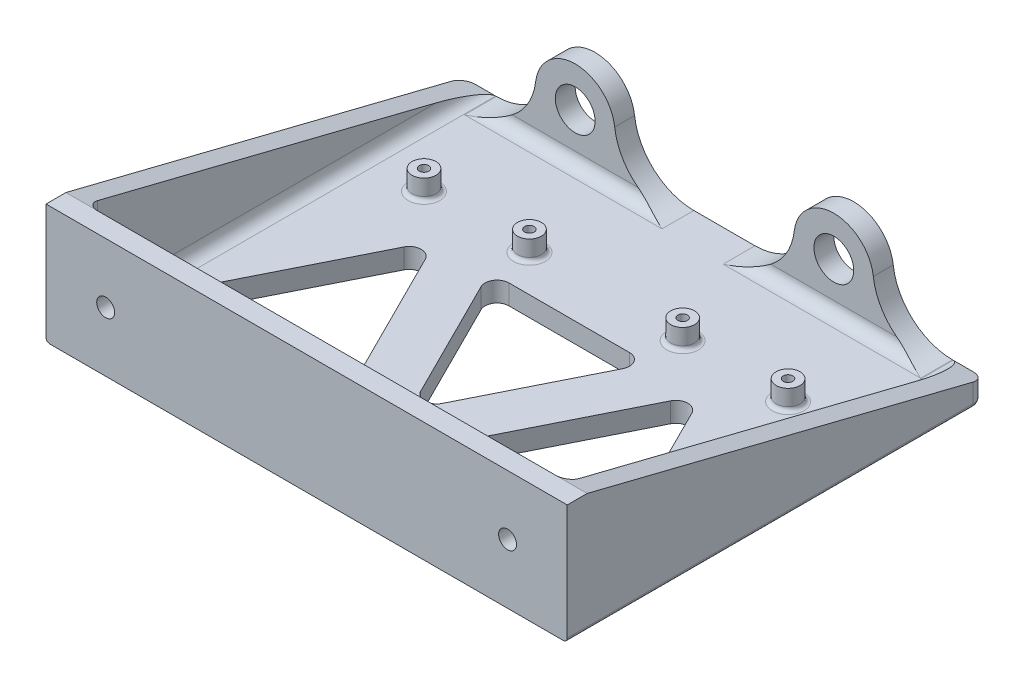
from build123d import *

# Parameters (mm, degrees)
SKETCH1_R             = 3
SKETCH1_R_2           = 1.2
BOSS_EXTRUDE1_DEPTH   = 10
BOSS_EXTRUDE1_2_DEPTH = 10
BOSS_EXTRUDE1_3_DEPTH = 10
BOSS_EXTRUDE1_4_DEPTH = 10
BOSS_EXTRUDE1_5_DEPTH = 10
BOSS_EXTRUDE1_6_DEPTH = 10
BOSS_EXTRUDE1_7_DEPTH = 10
BOSS_EXTRUDE1_8_DEPTH = 10
SKETCH2_W             = 131
SKETCH2_H             = 100
SKETCH2_R             = 1.2
BOSS_EXTRUDE2_DEPTH   = 5
SKETCH5_W             = 131
SKETCH5_H             = 30
BOSS_EXTRUDE4_DEPTH   = 5
BOSS_EXTRUDE5_DEPTH   = 5
FILLET2_R             = 3
SKETCH7_R             = 2.25
CUT_EXTRUDE2_DEPTH    = 5
SKETCH8_R             = 5
BOSS_EXTRUDE6_DEPTH   = 5
FILLET5_R             = 15
FILLET6_R             = 3
FILLET5_OF_MIRROR2_R  = 15
FILLET6_OF_MIRROR2_R  = 3
FILLET7_R             = 1
FILLET8_R             = 1
CUT_EXTRUDE3_DEPTH    = 5
FILLET9_R             = 3


with BuildPart() as part:
    # Sketch1 → Boss-Extrude1 (new body)
    with BuildSketch(Plane(origin=(0, 0, 0), x_dir=(1, 0, 0), z_dir=(0, 1, 0))):
        with Locations(Location((-45.75, 29.25, 0), (0, 0, 270))):
            Circle(SKETCH1_R)
        with Locations(Location((-45.75, 29.25, 0), (0, 0, 270))):
            Circle(SKETCH1_R_2, mode=Mode.SUBTRACT)
    extrude(amount=BOSS_EXTRUDE1_DEPTH)



with BuildPart() as body_2:
    # Sketch1 → Boss-Extrude1 2 (new body)
    with BuildSketch(Plane(origin=(0, 0, 0), x_dir=(1, 0, 0), z_dir=(0, 1, 0))):
        with Locations(Location((-19.25, 29.25, 0), (0, 0, 270))):
            Circle(SKETCH1_R)
        with Locations(Location((-19.25, 29.25, 0), (0, 0, 270))):
            Circle(SKETCH1_R_2, mode=Mode.SUBTRACT)
    extrude(amount=BOSS_EXTRUDE1_2_DEPTH)


with BuildPart() as body_3:
    # Sketch1 → Boss-Extrude1 3 (new body)
    with BuildSketch(Plane(origin=(0, 0, 0), x_dir=(1, 0, 0), z_dir=(0, 1, 0))):
        with Locations(Location((-45.75, -29.25, 0), (0, 0, 270))):
            Circle(SKETCH1_R)
        with Locations(Location((-45.75, -29.25, 0), (0, 0, 270))):
            Circle(SKETCH1_R_2, mode=Mode.SUBTRACT)
    extrude(amount=BOSS_EXTRUDE1_3_DEPTH)


with BuildPart() as body_4:
    # Sketch1 → Boss-Extrude1 4 (new body)
    with BuildSketch(Plane(origin=(0, 0, 0), x_dir=(1, 0, 0), z_dir=(0, 1, 0))):
        with Locations(Location((-19.25, -29.25, 0), (0, 0, 270))):
            Circle(SKETCH1_R)
        with Locations(Location((-19.25, -29.25, 0), (0, 0, 270))):
            Circle(SKETCH1_R_2, mode=Mode.SUBTRACT)
    extrude(amount=BOSS_EXTRUDE1_4_DEPTH)


with BuildPart() as body_5:
    # Sketch1 → Boss-Extrude1 5 (new body)
    with BuildSketch(Plane(origin=(0, 0, 0), x_dir=(1, 0, 0), z_dir=(0, 1, 0))):
        with Locations(Location((19.25, 29.25, 0), (0, 0, 270))):
            Circle(SKETCH1_R)
        with Locations(Location((19.25, 29.25, 0), (0, 0, 270))):
            Circle(SKETCH1_R_2, mode=Mode.SUBTRACT)
    extrude(amount=BOSS_EXTRUDE1_5_DEPTH)


with BuildPart() as body_6:
    # Sketch1 → Boss-Extrude1 6 (new body)
    with BuildSketch(Plane(origin=(0, 0, 0), x_dir=(1, 0, 0), z_dir=(0, 1, 0))):
        with Locations(Location((45.75, 29.25, 0), (0, 0, 270))):
            Circle(SKETCH1_R)
        with Locations(Location((45.75, 29.25, 0), (0, 0, 270))):
            Circle(SKETCH1_R_2, mode=Mode.SUBTRACT)
    extrude(amount=BOSS_EXTRUDE1_6_DEPTH)


with BuildPart() as body_7:
    # Sketch1 → Boss-Extrude1 7 (new body)
    with BuildSketch(Plane(origin=(0, 0, 0), x_dir=(1, 0, 0), z_dir=(0, 1, 0))):
        with Locations(Location((45.75, -29.25, 0), (0, 0, 270))):
            Circle(SKETCH1_R)
        with Locations(Location((45.75, -29.25, 0), (0, 0, 270))):
            Circle(SKETCH1_R_2, mode=Mode.SUBTRACT)
    extrude(amount=BOSS_EXTRUDE1_7_DEPTH)


with BuildPart() as body_8:
    # Sketch1 → Boss-Extrude1 8 (new body)
    with BuildSketch(Plane(origin=(0, 0, 0), x_dir=(1, 0, 0), z_dir=(0, 1, 0))):
        with Locations(Location((19.25, -29.25, 0), (0, 0, 270))):
            Circle(SKETCH1_R)
        with Locations(Location((19.25, -29.25, 0), (0, 0, 270))):
            Circle(SKETCH1_R_2, mode=Mode.SUBTRACT)
    extrude(amount=BOSS_EXTRUDE1_8_DEPTH)


with BuildPart() as part_1:
    add(part.part)

    add(body_2.part)  # Boss-Extrude2 merges body 2

    add(body_3.part)  # Boss-Extrude2 merges body 3

    add(body_4.part)  # Boss-Extrude2 merges body 4

    add(body_5.part)  # Boss-Extrude2 merges body 5

    add(body_6.part)  # Boss-Extrude2 merges body 6

    add(body_7.part)  # Boss-Extrude2 merges body 7

    add(body_8.part)  # Boss-Extrude2 merges body 8
    # Sketch2 → Boss-Extrude2 (add)
    with BuildSketch(Plane(origin=(0, 0, 0), x_dir=(1, 0, 0), z_dir=(0, 1, 0))):
        with Locations((0, 9)):
            Rectangle(SKETCH2_W, SKETCH2_H)
        with Locations(Location((45.75, -29.25, 0), (0, 0, 270))):
            Circle(SKETCH2_R, mode=Mode.SUBTRACT)
        with Locations(Location((19.25, -29.25, 0), (0, 0, 270))):
            Circle(SKETCH2_R, mode=Mode.SUBTRACT)
        with Locations(Location((-19.25, -29.25, 0), (0, 0, 270))):
            Circle(SKETCH2_R, mode=Mode.SUBTRACT)
        with Locations(Location((-45.75, -29.25, 0), (0, 0, 270))):
            Circle(SKETCH2_R, mode=Mode.SUBTRACT)
        with Locations(Location((-45.75, 29.25, 0), (0, 0, 270))):
            Circle(SKETCH2_R, mode=Mode.SUBTRACT)
        with Locations(Location((-19.25, 29.25, 0), (0, 0, 270))):
            Circle(SKETCH2_R, mode=Mode.SUBTRACT)
        with Locations(Location((19.25, 29.25, 0), (0, 0, 270))):
            Circle(SKETCH2_R, mode=Mode.SUBTRACT)
        with Locations(Location((45.75, 29.25, 0), (0, 0, 270))):
            Circle(SKETCH2_R, mode=Mode.SUBTRACT)
    extrude(amount=BOSS_EXTRUDE2_DEPTH)

    # Sketch5 → Boss-Extrude4 (add)
    with BuildSketch(Plane.XY.offset(41)):
        with Locations((0, 15)):
            Rectangle(SKETCH5_W, SKETCH5_H)
    extrude(amount=BOSS_EXTRUDE4_DEPTH)

    # Sketch6 → Boss-Extrude5 (add)
    with BuildSketch(Plane.ZY.offset(65.5)):
        Polygon((-59, 5), (41, 30), (41, 5), align=None)
    boss_extrude5 = extrude(amount=-BOSS_EXTRUDE5_DEPTH)

    # Mirror1: Boss-Extrude5 across plane
    add(boss_extrude5.mirror(Plane(origin=(0, 0, 0), x_dir=(0, 0, 1), z_dir=(1, 0, 0))))

    # Fillet2
    fillet2_edges = [part_1.edges().sort_by_distance(p)[0] for p in [
        (60.5, 5, -9),
        (60.5, 17.5, 41),
        (-65.5, 2.5, -59),
        (65.5, 2.5, -59),
        (0, 5, 41),
        (-60.5, 5, -9),
        (-60.5, 17.5, 41),
    ]]
    fillet(fillet2_edges, radius=FILLET2_R)

    # Sketch7 → Cut-Extrude2 (cut)
    with BuildSketch(Plane.XY.offset(46)):
        with Locations((-50.5, 15)):
            Circle(SKETCH7_R)
        with Locations((50.5, 15)):
            Circle(SKETCH7_R)
    extrude(amount=-CUT_EXTRUDE2_DEPTH, mode=Mode.SUBTRACT)

    # Sketch8 → Boss-Extrude6 (add)
    with BuildSketch(Plane(origin=(0, 0, -59), x_dir=(-1, 0, 0), z_dir=(0, 0, -1))):
        with BuildLine():
            Line((-42.5, 17), (-42.5, 0))
            Line((-42.5, 0), (-22.5, 0))
            Line((-22.5, 0), (-22.5, 17))
            ThreePointArc((-22.5, 17), (-32.5, 27), (-42.5, 17))
        make_face()
        with Locations((-32.5, 17)):
            Circle(SKETCH8_R, mode=Mode.SUBTRACT)
    boss_extrude6 = extrude(amount=-BOSS_EXTRUDE6_DEPTH)

    # Fillet5
    # the kernel refuses this fillet: 15 mm, written as the material it adds along each edge
    with BuildSketch(Plane(origin=(22.5, 5, -59), x_dir=(-1, 0, 0), z_dir=(0, 0, 1)), Plane(origin=(42.5, 5, -54), x_dir=(1, 0, 0), z_dir=(0, 0, -1))) as fillet5_piece_1:
        with BuildLine():
            CenterArc((14.819347292, -15), FILLET5_R, 90, 83.107897421)
            Line((-0.072261083, -13.2), (-1.561421921, -13.02))
            ThreePointArc((-1.561421921, -13.02), (-1.5, -12), (-1.5, 0))
            Line((-1.5, 0), (0, 1.5))
            Line((0, 1.5), (14.819347292, 1.5))
            Line((14.819347292, 1.5), (14.819347292, 0))
        make_face()
    extrude(amount=5)

    # Fillet6
    fillet6_edges = [part_1.edges().sort_by_distance(p)[0] for p in [
        (32.5, 5, -54),
    ]]
    fillet(fillet6_edges, radius=FILLET6_R)

    # Mirror2: Boss-Extrude6 across plane
    add(boss_extrude6.mirror(Plane(origin=(0, 0, 0), x_dir=(0, 0, 1), z_dir=(1, 0, 0))))

    # Fillet5 of Mirror2
    # the kernel refuses this fillet: 15 mm, written as the material it adds along each edge
    with BuildSketch(Plane(origin=(-22.5, 5, -59), x_dir=(-0.005474242459339525, 0.9999850162224914, 0), z_dir=(0, 0, 1)), Plane(origin=(-42.5, 5, -54), x_dir=(0.0054742424593400615, 0.9999850162224914, 0), z_dir=(0, 0, -1))) as fillet5_of_mirror2_piece_1:
        with BuildLine():
            CenterArc((14.918650543, -14.901238879), FILLET5_OF_MIRROR2_R, 96.578450024, 83.107897421)
            Line((-0.0811247, -14.819125242), (-1.581102225, -14.810913878))
            Line((-1.581102225, -14.810913878), (-1.499977524, 0.008211364))
            Line((-1.499977524, 0.008211364), (0.008211364, 1.499977524))
            ThreePointArc((0.008211364, 1.499977524), (12.008031558, 1.434286615), (13.028352513, 1.490123888))
            Line((13.028352513, 1.490123888), (13.200197789, 0))
        make_face()
    extrude(amount=5)

    # Fillet6 of Mirror2
    fillet6_of_mirror2_edges = [part_1.edges().sort_by_distance(p)[0] for p in [
        (-32.5, 5, -54),
    ]]
    fillet(fillet6_of_mirror2_edges, radius=FILLET6_OF_MIRROR2_R)

    # Fillet7
    fillet7_edges = [part_1.edges().sort_by_distance(p)[0] for p in [
        (-19.25, 5, -32.25),
        (-45.75, 5, 26.25),
        (-19.25, 5, 26.25),
        (19.25, 5, -32.25),
        (45.75, 5, -32.25),
        (45.75, 5, 26.25),
        (19.25, 5, 26.25),
        (-45.75, 5, -32.25),
    ]]
    fillet(fillet7_edges, radius=FILLET7_R)

    # Fillet8
    fillet8_edges = [part_1.edges().sort_by_distance(p)[0] for p in [
        (0, 0, -59),
        (-65.5, 0, -5),
        (-64.621320344, 0, -58.121320344),
        (64.621320344, 0, -58.121320344),
        (65.5, 0, -5),
    ]]
    fillet(fillet8_edges, radius=FILLET8_R)

    # Sketch11 → Cut-Extrude3 (cut)
    with BuildSketch(Plane(origin=(0, 5, 0), x_dir=(1, 0, 0), z_dir=(0, 1, 0))):
        Polygon((-53.5, -20), (-33.5, 20), (-13.5, -20), align=None)
        Polygon((-20, 20), (0, -20), (20, 20), align=None)
        Polygon((33.5, 20), (13.5, -20), (53.5, -20), align=None)
    extrude(amount=-CUT_EXTRUDE3_DEPTH, mode=Mode.SUBTRACT)

    # Fillet9
    fillet9_edges = [part_1.edges().sort_by_distance(p)[0] for p in [
        (-20, 2.5, -20),
        (20, 2.5, -20),
        (0, 2.5, 20),
        (33.5, 2.5, -20),
        (53.5, 2.5, 20),
        (13.5, 2.5, 20),
        (-13.5, 2.5, 20),
        (-53.5, 2.5, 20),
        (-33.5, 2.5, -20),
    ]]
    fillet(fillet9_edges, radius=FILLET9_R)


solid = part_1.part
